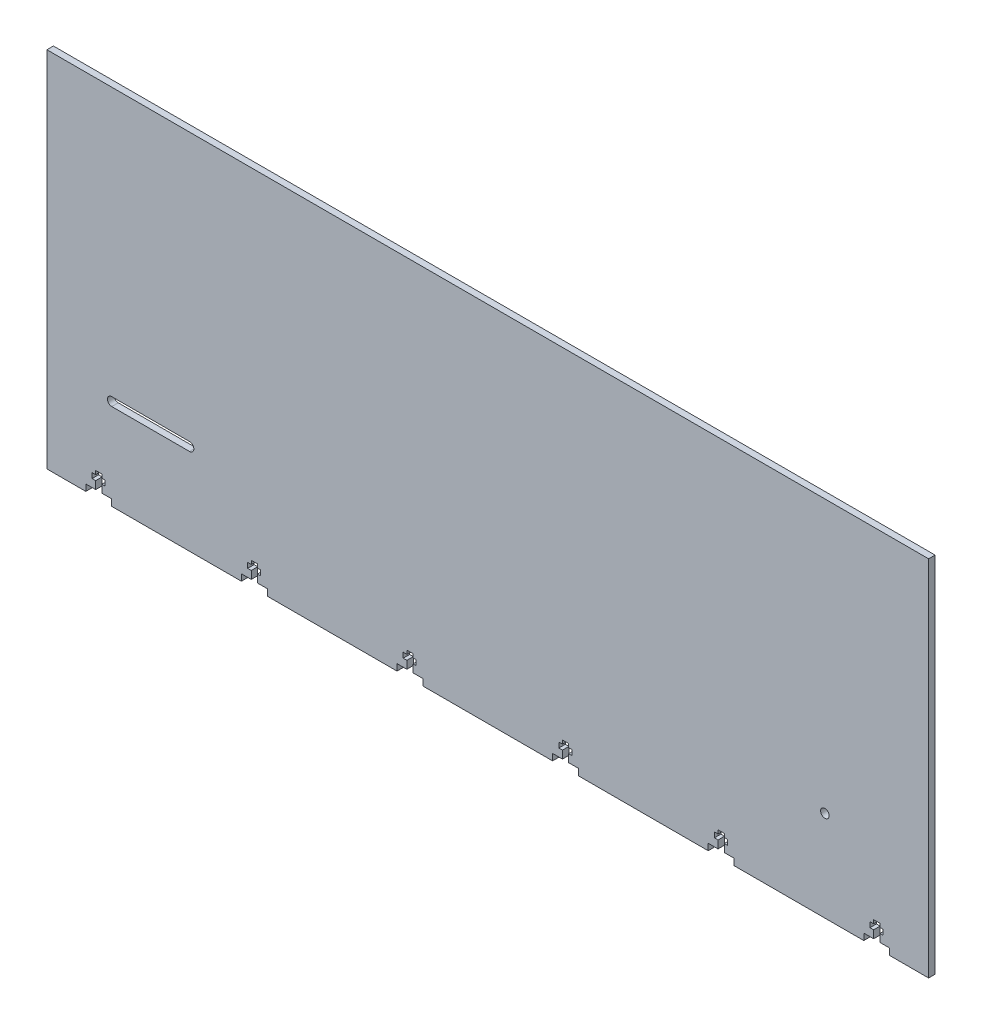
from build123d import *

# Parameters (mm, degrees)
SKETCH1_W           = 431.8
SKETCH1_H           = 177.8
BOSS_EXTRUDE1_DEPTH = 3.175
CUT_EXTRUDE1_DEPTH  = 3.175
CUT_EXTRUDE2_DEPTH  = 3.175
LPATTERN1_COUNT     = 6
LPATTERN1_PITCH     = 76.2
SKETCH7_R           = 2.1
CUT_EXTRUDE3_DEPTH  = 3.175


with BuildPart() as part:
    # Sketch1 → Boss-Extrude1 (new body)
    with BuildSketch(Plane.XY):
        with Locations((215.9, 88.9)):
            Rectangle(SKETCH1_W, SKETCH1_H)
    extrude(amount=BOSS_EXTRUDE1_DEPTH)

    # Sketch2 → Cut-Extrude1 (cut)
    with BuildSketch(Plane.XY.offset(3.175)):
        with BuildLine():
            Line((31.75, 46.55), (69.85, 46.55))
            ThreePointArc((69.85, 46.55), (71.95, 44.45), (69.85, 42.35))
            Line((69.85, 42.35), (31.75, 42.35))
            ThreePointArc((31.75, 42.35), (29.65, 44.45), (31.75, 46.55))
        make_face()
    extrude(amount=-CUT_EXTRUDE1_DEPTH, mode=Mode.SUBTRACT)

    # Sketch6 → Cut-Extrude2 (cut)
    with BuildSketch(Plane.XY.offset(3.175)):
        Polygon((19.05, 0), (31.75, 0), (31.75, 3.175), (26.924, 3.175), (26.924, 6.985), (28.448, 6.985), (28.448, 9.525), (26.924, 9.525), (26.924, 11.303), (23.876, 11.303), (23.876, 9.525), (22.098, 9.525), (22.098, 6.985), (23.876, 6.985), (23.876, 3.175), (19.05, 3.175), align=None)
    cut_extrude2 = extrude(amount=-CUT_EXTRUDE2_DEPTH, mode=Mode.SUBTRACT)

    # LPattern1: Cut-Extrude2 ×6
    with Locations(*[(i * LPATTERN1_PITCH, 0, 0) for i in range(1, LPATTERN1_COUNT)]):
        add(cut_extrude2, mode=Mode.SUBTRACT)

    # Sketch7 → Cut-Extrude3 (cut)
    with BuildSketch(Plane.XY.offset(3.175)):
        with Locations((381, 44.45)):
            Circle(SKETCH7_R)
    extrude(amount=-CUT_EXTRUDE3_DEPTH, mode=Mode.SUBTRACT)


solid = part.part
